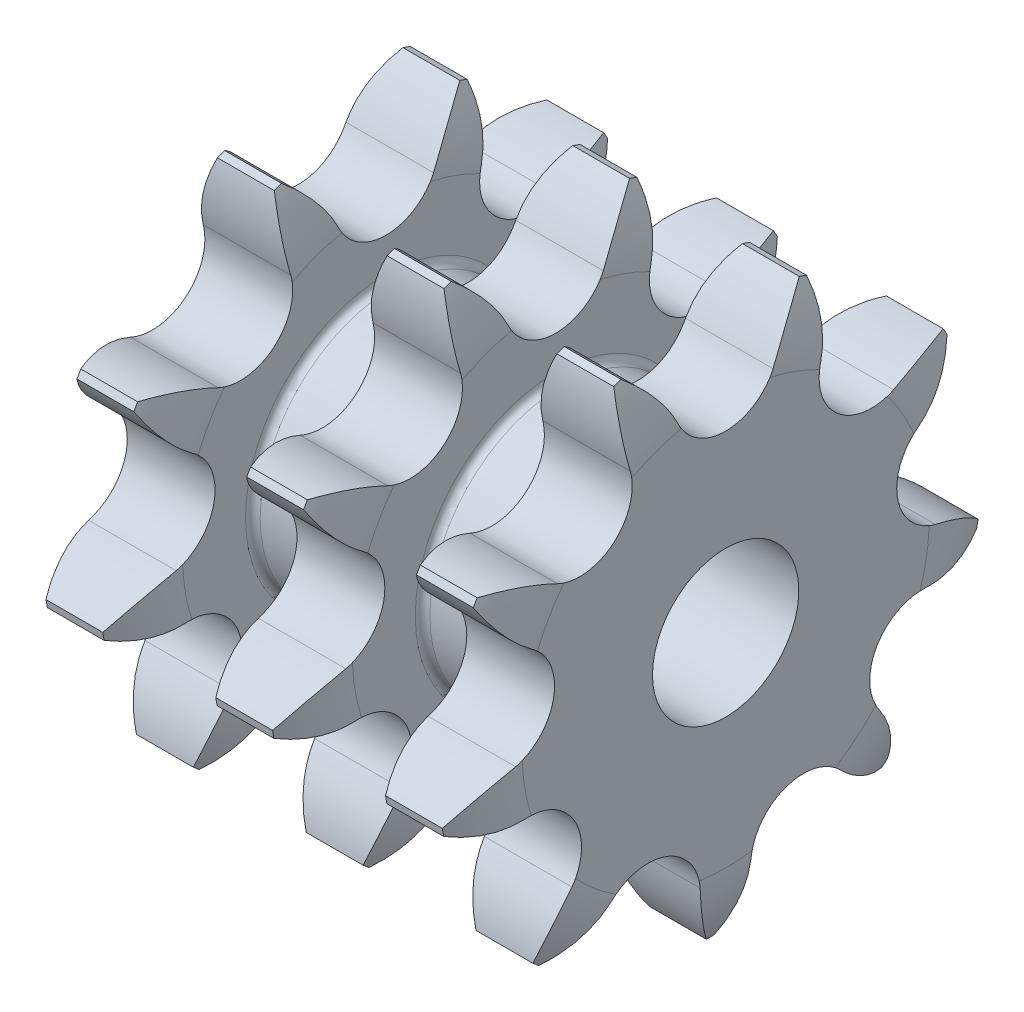
from build123d import *

# Parameters (mm, degrees)
GROOVES_COUNT   = 2
GROOVES_PITCH   = 13.92
TOOTHCUT_DEPTH  = 48.093600013
TEETHCUTS_COUNT = 9
TEETHCUTS_ANGLE = 320
BORSKE_R        = 6
BORE_DEPTH      = 37.2405


with BuildPart() as part:
    # BasProSke → Base-Revolve (revolve)
    with BuildSketch(Plane(origin=(0, 0, 0), x_dir=(1, 0, 0), z_dir=(0, 1, 0))):
        with BuildLine():
            Line((0, 0), (0, 16.712856303))
            ThreePointArc((0, 16.712856303), (0.321571182, 19.552662635), (1.27, 22.248657961))
            Line((1.27, 22.248657961), (33.77, 22.248657961))
            ThreePointArc((33.77, 22.248657961), (34.718428818, 19.552662635), (35.04, 16.712856303))
            Line((35.04, 16.712856303), (35.04, 0))
            Line((35.04, 0), (0, 0))
        make_face()
    revolve(axis=Axis((-10, 0, 0), (1, 0, 0)))

    # GrvSke → Groove (revolve, cut)
    with BuildSketch(Plane(origin=(0, 0, 0), x_dir=(1, 0, 0), z_dir=(0, 1, 0))):
        with BuildLine():
            Line((7.2, 16.712856303), (7.2, 11.530481635))
            ThreePointArc((7.2, 11.530481635), (7.375735931, 11.106217566), (7.8, 10.930481635))
            Line((7.8, 10.930481635), (13.32, 10.930481635))
            ThreePointArc((13.32, 10.930481635), (13.744264069, 11.106217566), (13.92, 11.530481635))
            Line((13.92, 11.530481635), (13.92, 16.712856303))
            ThreePointArc((13.92, 16.712856303), (14.241571182, 19.552662635), (15.19, 22.248657961))
            Line((15.19, 22.248657961), (5.93, 22.248657961))
            ThreePointArc((5.93, 22.248657961), (6.878428818, 19.552662635), (7.2, 16.712856303))
        make_face()
    groove = revolve(axis=Axis((0, 0, 0), (1, 0, 0)), mode=Mode.SUBTRACT)

    # Grooves: Groove ×2
    with Locations(*[(i * GROOVES_PITCH, 0, 0) for i in range(1, GROOVES_COUNT)]):
        add(groove, mode=Mode.SUBTRACT)

    # TooCutSke → ToothCut (cut, through all)
    with BuildSketch(Plane(origin=(0, 0, 0), x_dir=(0, 0, -1), z_dir=(1, 0, 0))):
        with BuildLine():
            ThreePointArc((3.89490303, 16.792484851), (5.53909395, 19.346647696), (7.807509589, 21.366895728))
            ThreePointArc((7.807509589, 21.366895728), (0, 22.748657961), (-7.807509589, 21.366895728))
            ThreePointArc((-7.807509589, 21.366895728), (-5.53909395, 19.346647696), (-3.89490303, 16.792484851))
            ThreePointArc((-3.89490303, 16.792484851), (0, 14.311157961), (3.89490303, 16.792484851))
        make_face()
    toothcut = extrude(amount=TOOTHCUT_DEPTH, mode=Mode.SUBTRACT)

    # TeethCuts: ToothCut ×9 about axis
    teethcuts_axis = Axis((-10, 0, 0), (1, 0, 0))
    for i in range(1, TEETHCUTS_COUNT):
        add(toothcut.rotate(teethcuts_axis, i * TEETHCUTS_ANGLE / (TEETHCUTS_COUNT - 1)), mode=Mode.SUBTRACT)

    # BorSke → Bore (cut, symmetric)
    with BuildSketch(Plane(origin=(0, 0, 0), x_dir=(0, 0, -1), z_dir=(1, 0, 0))):
        Circle(BORSKE_R)
    extrude(amount=BORE_DEPTH, both=True, mode=Mode.SUBTRACT)


solid = part.part
